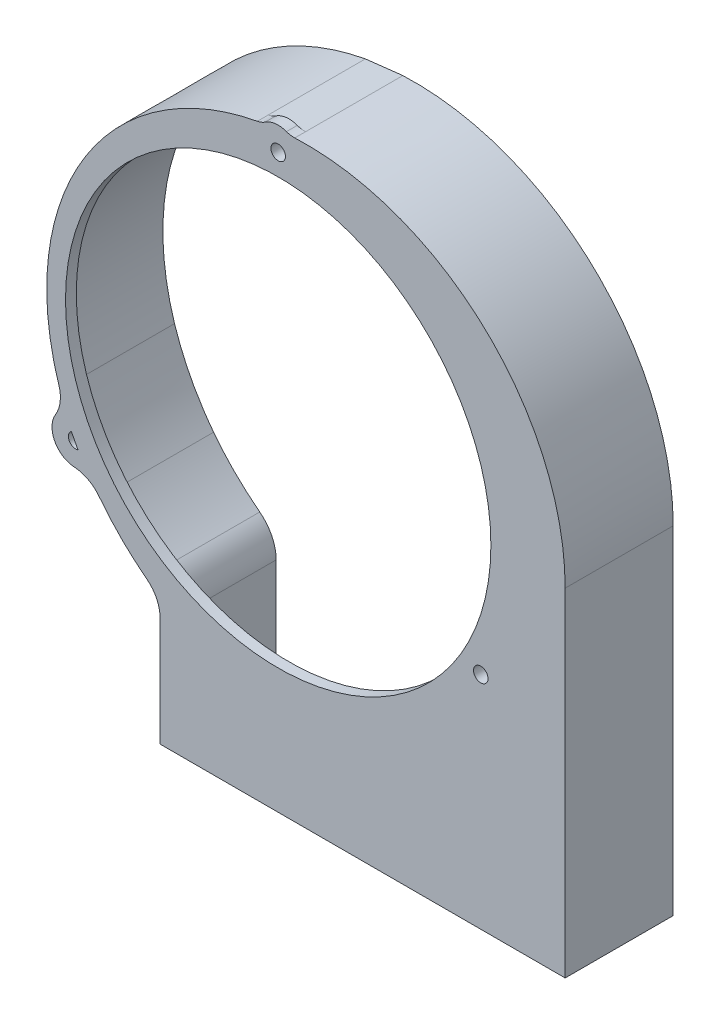
from build123d import *

# Parameters (mm, degrees)
SKETCH1_R           = 1.075
SKETCH1_R_2         = 31.5
EXTRUDE_BASE_DEPTH  = 1.6
BOSS_EXTRUDE9_START = -16
BOSS_EXTRUDE9_DEPTH = 16


with BuildPart() as part:
    # Sketch1 → extrude-base (new body)
    with BuildSketch(Plane.XY):
        with BuildLine():
            Line((-17.5, -33.771878401), (-17.5, -50))
            Line((-17.5, -50), (42.5, -50))
            Line((42.5, -50), (42.5, -32.5))
            Line((42.5, -32.5), (42.5, 0))
            add(Edge.make_bspline(
                [(42.5, 0), (42.5, 39.41992847), (2.459020818, 37.72319297)],
                knots=[3.141592654, 3.141592654, 3.141592654, 4.755444864, 4.755444864, 4.755444864], degree=2, weights=[1, 0.691721555, 1]))
            ThreePointArc((2.459020818, 37.72319297), (1.83256577, 37.75937423), (1.22579937, 37.919341562))
            ThreePointArc((1.22579937, 37.919341562), (-0.398220056, 38.118288195), (-1.935215493, 37.5573391))
            ThreePointArc((-1.935215493, 37.5573391), (-2.490054876, 37.26435889), (-3.09205194, 37.087486962))
            add(Edge.make_bspline(
                [(-3.09205194, 37.087486962), (-45.49154498, 29.120596422), (-32.496359083, -11.367088447)],
                knots=[4.901152551, 4.901152551, 4.901152551, 6.588978479, 6.588978479, 6.588978479], degree=2, weights=[1, 0.664543961, 1]))
            ThreePointArc((-32.496359083, -11.367088447), (-32.292210371, -13.486281945), (-32.988235187, -15.498297659))
            ThreePointArc((-32.988235187, -15.498297659), (-33.099394368, -18.946470872), (-30.199142861, -20.814838092))
            ThreePointArc((-30.199142861, -20.814838092), (-28.146562368, -21.386545462), (-26.51838784, -22.760948497))
            add(Edge.make_bspline(
                [(-26.51838784, -22.760948497), (-23.462509142, -26.739328), (-19.46142089, -29.801105555)],
                knots=[0.647016148, 0.647016148, 0.647016148, 0.90960641, 0.90960641, 0.90960641], degree=2, weights=[1, 0.991393169, 1]))
            ThreePointArc((-19.46142089, -29.801105555), (-18.017093825, -31.557481818), (-17.5, -33.771878401))
        make_face()
        with Locations((-30.000000067, -17.320508092)):
            Circle(SKETCH1_R, mode=Mode.SUBTRACT)
        with Locations((29.999999933, -17.320508323)):
            Circle(SKETCH1_R, mode=Mode.SUBTRACT)
        Circle(SKETCH1_R_2, mode=Mode.SUBTRACT)
        with Locations((4.75e-07, 34.641016217)):
            Circle(SKETCH1_R, mode=Mode.SUBTRACT)
    extrude(amount=EXTRUDE_BASE_DEPTH)

    # Sketch10 → Boss-Extrude9 (add)
    with BuildSketch(Plane.XY.offset(1.6).offset(BOSS_EXTRUDE9_START)):
        with BuildLine():
            ThreePointArc((-19.46142089, -29.801105555), (-18.017093825, -31.557481818), (-17.5, -33.771878401))
            Line((-17.5, -33.771878401), (-17.5, -50))
            Line((-17.5, -50), (-16.3, -50))
            Line((-16.3, -50), (-16.3, -33.771878401))
            ThreePointArc((-16.3, -33.771878401), (-16.941196343, -31.026026638), (-18.732161904, -28.848120072))
            add(Edge.make_bspline(
                [(-25.566729106, -22.029958994), (-24.578050638, -23.317097176), (-23.512848671, -24.527527727), (-21.234325104, -26.799912781), (-20.020994759, -27.86185852), (-18.732161904, -28.848120072)],
                knots=[0, 0, 0, 0, 0.5, 0.5, 1, 1, 1, 1], degree=3))
            add(Edge.make_bspline(
                [(-31.353771063, -11.0003561), (-29.402926574, -17.009997513), (-25.566729106, -22.029958994)],
                knots=[0, 0, 0, 1, 1, 1], degree=2))
            add(Edge.make_bspline(
                [(-2.870449298, 35.908126004), (-5.436468745, 35.425969389), (-7.908446803, 34.688998483), (-11.48013295, 33.214275651), (-12.647794485, 32.660650203), (-14.363814313, 31.73409591), (-14.931182069, 31.408323469), (-16.041505892, 30.731515452), (-16.585711755, 30.37989631), (-19.252842137, 28.55678796), (-21.21583927, 26.892395093), (-23.899624838, 24.081338464), (-24.753908137, 23.085995606), (-26.334922562, 21.031961865), (-27.797139019, 18.907327708), (-29.02559046, 16.643769396), (-29.85775681, 14.89310652), (-30.120253088, 14.300701764), (-30.614818965, 13.09780999), (-30.847268804, 12.485965885), (-31.91914351, 9.417171687), (-32.501482258, 6.908170216), (-32.891543237, 3.705654906), (-32.95248376, 3.061803653), (-33.039647527, 1.767292199), (-33.065881554, 1.115023359), (-33.091085507, -0.840788011), (-33.036991084, -2.134381266), (-32.669118059, -5.985347855), (-32.152051166, -8.513241755), (-31.353771063, -11.0003561)],
                knots=[0, 0, 0, 0, 0.125, 0.125, 0.1875, 0.1875, 0.21875, 0.21875, 0.25, 0.25, 0.375, 0.375, 0.4375, 0.4375, 0.5, 0.5625, 0.5625, 0.59375, 0.59375, 0.625, 0.625, 0.75, 0.75, 0.78125, 0.78125, 0.8125, 0.8125, 0.875, 0.875, 1, 1, 1, 1], degree=3))
            Line((-2.870449298, 35.908126004), (2.509825196, 36.524268905))
            add(Edge.make_bspline(
                [(41.3, 0), (41.3, 2.502818734), (41.04130208, 4.961429188), (40.281620587, 8.585837104), (39.96596084, 9.783304118), (39.396449767, 11.56309576), (39.189952319, 12.155110401), (38.748973333, 13.321274183), (38.514247241, 13.896469279), (37.270860158, 16.73380096), (36.055043738, 18.881177517), (33.900747967, 21.919112448), (33.122655894, 22.905459572), (31.485713181, 24.776139158), (30.624910971, 25.664331897), (28.820846522, 27.34887544), (27.877579605, 28.145221035), (26.400572769, 29.270566792), (25.897866794, 29.634131792), (24.87143267, 30.337847815), (24.346202787, 30.678892445), (21.687758086, 32.311479515), (19.463384623, 33.386508759), (15.985995879, 34.665741305), (14.803214467, 35.036173284), (12.992635871, 35.505654836), (12.382473166, 35.647787608), (11.162128702, 35.90033819), (10.550473443, 36.011175912), (7.484880127, 36.489198015), (5.009211723, 36.630180347), (2.509825196, 36.524268905)],
                knots=[0, 0, 0, 0, 0.125, 0.125, 0.1875, 0.1875, 0.21875, 0.21875, 0.25, 0.25, 0.375, 0.375, 0.4375, 0.4375, 0.5, 0.5, 0.5625, 0.5625, 0.59375, 0.59375, 0.625, 0.625, 0.75, 0.75, 0.8125, 0.8125, 0.84375, 0.84375, 0.875, 0.875, 1, 1, 1, 1], degree=3))
            Line((41.3, 0), (41.3, -50))
            Line((41.3, -50), (42.5, -50))
            Line((42.5, -50), (42.5, 0))
            add(Edge.make_bspline(
                [(42.5, 0), (42.5, 7.272816374), (40.709520889, 15.38048571), (36.377186956, 23.35544507), (29.466953178, 29.575937448), (18.075350288, 35.422775935), (14.077470504, 36.812411099), (10.05106521, 37.607236379), (6.150506462, 37.879619583), (2.459020818, 37.72319297)],
                knots=[3.141592654, 3.141592654, 3.141592654, 3.141592654, 3.141592654, 3.141592654, 4.217709058, 4.217709058, 4.217709058, 4.217709058, 4.755444864, 4.755444864, 4.755444864, 4.755444864, 4.755444864, 4.755444864], degree=5, weights=[1, 1, 0.994320542, 0.991840126, 1, 1, 0.999817369, 0.999954298, 1, 1]))
            Line((2.459020818, 37.72319297), (-3.09205194, 37.087486962))
            add(Edge.make_bspline(
                [(-3.09205194, 37.087486962), (-6.72994006, 36.403925571), (-10.480917897, 35.251851793), (-14.244234311, 33.553120472), (-17.846077918, 31.264686538), (-27.980885292, 22.572968302), (-33.523658499, 14.25864054), (-35.587689769, 4.733827824), (-34.835717499, -4.078604305), (-32.496359083, -11.367088447)],
                knots=[4.901152551, 4.901152551, 4.901152551, 4.901152551, 4.901152551, 4.901152551, 5.445946934, 5.445946934, 5.445946934, 5.445946934, 6.588978479, 6.588978479, 6.588978479, 6.588978479, 6.588978479, 6.588978479], degree=5, weights=[1, 1, 1.000006691, 0.999854596, 1, 1, 0.989527804, 0.992928488, 1, 1]))
            ThreePointArc((-32.496359083, -11.367088447), (-32.432859758, -11.58125406), (-32.378989521, -11.79804214))
            add(Edge.make_bspline(
                [(-32.378989521, -11.79804214), (-30.718117642, -17.725309457), (-26.826041177, -22.397628937)],
                knots=[0.033678654, 0.033678654, 0.033678654, 0.963651852, 0.963651852, 0.963651852], degree=2))
            ThreePointArc((-26.826041177, -22.397628937), (-26.667887831, -22.575624954), (-26.51838784, -22.760948497))
            add(Edge.make_bspline(
                [(-26.51838784, -22.760948497), (-23.462509142, -26.739328), (-19.46142089, -29.801105555)],
                knots=[0.647016148, 0.647016148, 0.647016148, 0.90960641, 0.90960641, 0.90960641], degree=2, weights=[1, 0.991393169, 1]))
        make_face()
    extrude(amount=BOSS_EXTRUDE9_DEPTH)


solid = part.part
